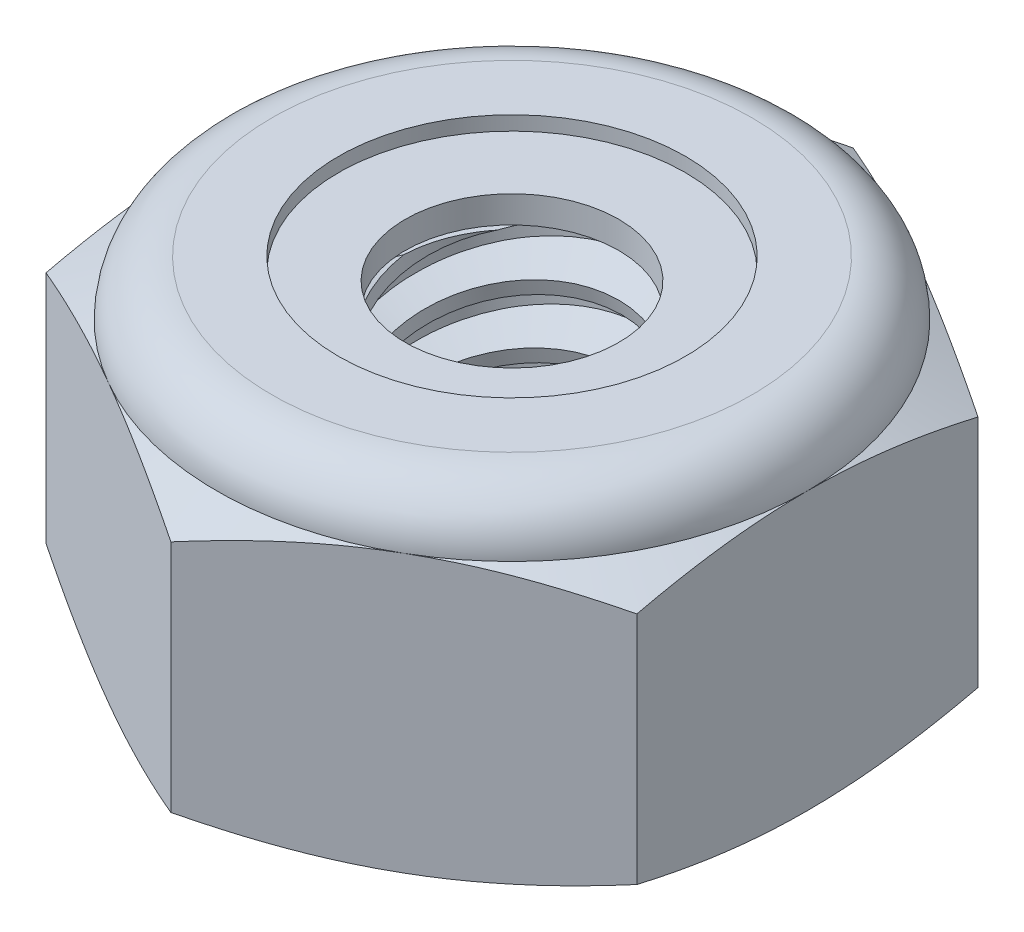
from build123d import *

# Parameters (mm, degrees)
EXTRUDE1_DEPTH       = 3.571875
SKETCH2_W            = 1.4224
SKETCH2_H            = 3.571875
LPATTERN1_COUNT      = 6
LPATTERN1_PITCH      = 0.635
LPATTERN1_COUNT_DIR2 = 2
LPATTERN1_PITCH_DIR2 = 0.635


with BuildPart() as part:
    # Sketch1 → Extrude1 (new body)
    with BuildSketch(Plane(origin=(0, 0, 0), x_dir=(1, 0, 0), z_dir=(0, 1, 0))):
        Polygon((0, 3.666174209), (-3.175, 1.833087105), (-3.175, -1.833087105), (0, -3.666174209), (3.175, -1.833087105), (3.175, 1.833087105), align=None)
    extrude(amount=EXTRUDE1_DEPTH)

    # Sketch4 → Cut-Revolve2 (revolve, cut)
    with BuildSketch(Plane(origin=(0, 0, 0), x_dir=(0, 0, -1), z_dir=(1, 0, 0))):
        Polygon((0, 3.571875), (1.4224, 3.571875), (1.147473684, 3.443674754), (1.147473684, 0.128200246), (1.4224, 0), (0, 0), align=None)
    revolve(axis=Axis((0, 3.571875, 0), (0, 1, 0)), mode=Mode.SUBTRACT)


with BuildPart() as body_2:
    # Sketch2 → Revolve1 (revolve)
    with BuildSketch(Plane(origin=(0, 0, 0), x_dir=(0, 0, -1), z_dir=(1, 0, 0))):
        with Locations((0.7112, 1.7859375)):
            Rectangle(SKETCH2_W, SKETCH2_H)
    revolve(axis=Axis((0, -1.4224, 0), (0, 1, 0)))

    # Sketch3 → Cut-Revolve1 (revolve, cut)
    with BuildSketch(Plane(origin=(0, 0, 0), x_dir=(0, 0, -1), z_dir=(1, 0, 0))):
        Polygon((1.439692084, 3.494406462), (1.560736676, 2.952126693), (1.182057853, 3.070921117), (1.147473684, 3.225858194), align=None)
    cut_revolve1 = revolve(axis=Axis((0, 3.571875, 0.152561988), (0, -0.9759815859905213, -0.2178530325871704)), mode=Mode.SUBTRACT)

    # LPattern1: Cut-Revolve1 6 × 2
    with Locations(*[Vector(0, -1, 0) * (i * LPATTERN1_PITCH) + Vector(0, 1, 0) * (j * LPATTERN1_PITCH_DIR2) for i in range(LPATTERN1_COUNT) for j in range(LPATTERN1_COUNT_DIR2) if (i, j) != (0, 0)]):
        add(cut_revolve1, mode=Mode.SUBTRACT)


with BuildPart() as part_1:
    add(part.part)

    # Combine1: cut body 2
    add(body_2.part, mode=Mode.SUBTRACT)

    # Sketch5 → Cut-Revolve3 (revolve, cut)
    with BuildSketch(Plane(origin=(0, 0, 0), x_dir=(0, 0, -1), z_dir=(1, 0, 0))):
        with BuildLine():
            Line((0, 0), (3.175, 0))
            Line((3.175, 0), (3.666174209, 0.229038295))
            Line((3.666174209, 0.229038295), (3.666174209, 2.747524205))
            Line((3.666174209, 2.747524205), (3.175, 2.9765625))
            ThreePointArc((3.175, 2.9765625), (3.000637006, 3.397512006), (2.5796875, 3.571875))
            Line((2.5796875, 3.571875), (2.5796875, 4.841875))
            Line((2.5796875, 4.841875), (4.936174209, 4.841875))
            Line((4.936174209, 4.841875), (4.936174209, -1.27))
            Line((4.936174209, -1.27), (0, -1.27))
            Line((0, -1.27), (0, 0))
        make_face()
    revolve(axis=Axis((0, 0, 0), (0, 1, 0)), mode=Mode.SUBTRACT)

    # Sketch6 → Cut-Revolve4 (revolve, cut)
    with BuildSketch(Plane(origin=(0, 0, 0), x_dir=(0, 0, -1), z_dir=(1, 0, 0))):
        with BuildLine():
            Line((0, 2.9765625), (3.0226, 2.9765625))
            ThreePointArc((3.0226, 2.9765625), (2.892873932, 3.289748932), (2.5796875, 3.419475))
            Line((2.5796875, 3.419475), (1.863580592, 3.419475))
            Line((1.863580592, 3.419475), (1.863580592, 4.841875))
            Line((1.863580592, 4.841875), (0, 4.841875))
            Line((0, 4.841875), (0, 2.9765625))
        make_face()
    revolve(axis=Axis((0, 4.841875, 0), (0, 1, 0)), mode=Mode.SUBTRACT)


with BuildPart() as body_2_2:
    # Sketch7 → Revolve2 (revolve)
    with BuildSketch(Plane(origin=(0, 0, 0), x_dir=(0, 0, -1), z_dir=(1, 0, 0))):
        with BuildLine():
            Line((1.147473684, 3.0527625), (2.938395763, 3.0527625))
            ThreePointArc((2.938395763, 3.0527625), (2.810484559, 3.261537543), (2.5796875, 3.343275))
            Line((2.5796875, 3.343275), (1.147473684, 3.343275))
            Line((1.147473684, 3.343275), (1.147473684, 3.0527625))
        make_face()
    revolve(axis=Axis((0, 3.0527625, 0), (0, 1, 0)))


solid = Compound([part_1.part, body_2_2.part])
